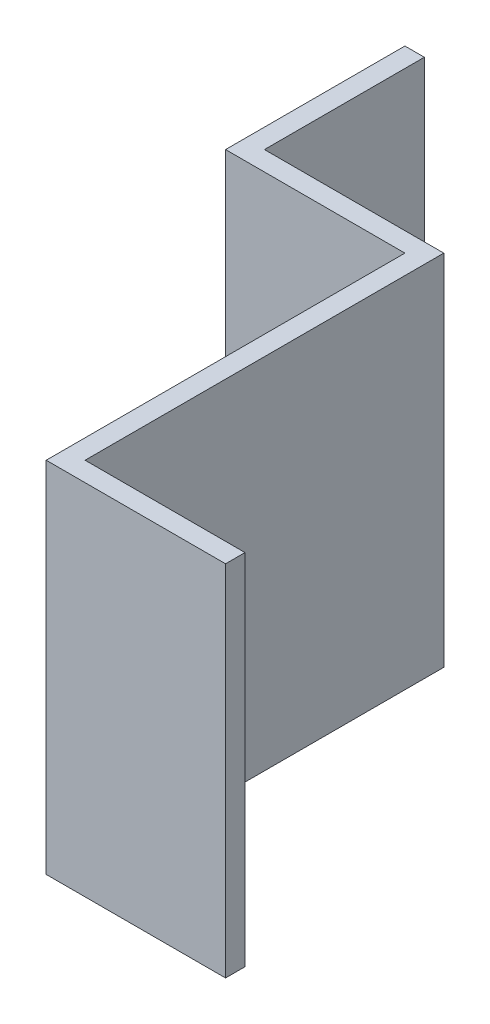
from build123d import *

# Parameters (mm, degrees)
BOSS_EXTRUDE1_DEPTH = 50.8


with BuildPart() as part:
    # Sketch1 → Boss-Extrude1 (new body)
    with BuildSketch(Plane(origin=(0, 0, 0), x_dir=(1, 0, 0), z_dir=(0, 1, 0))):
        Polygon((-9.94664, 28.15336), (15.45336, 28.15336), (15.45336, -22.64664), (38.1, -22.64664), (38.1, -25.4), (12.7, -25.4), (12.7, 25.4), (-12.7, 25.4), (-12.7, 50.8), (-9.94664, 50.8), align=None)
    extrude(amount=BOSS_EXTRUDE1_DEPTH)


solid = part.part
